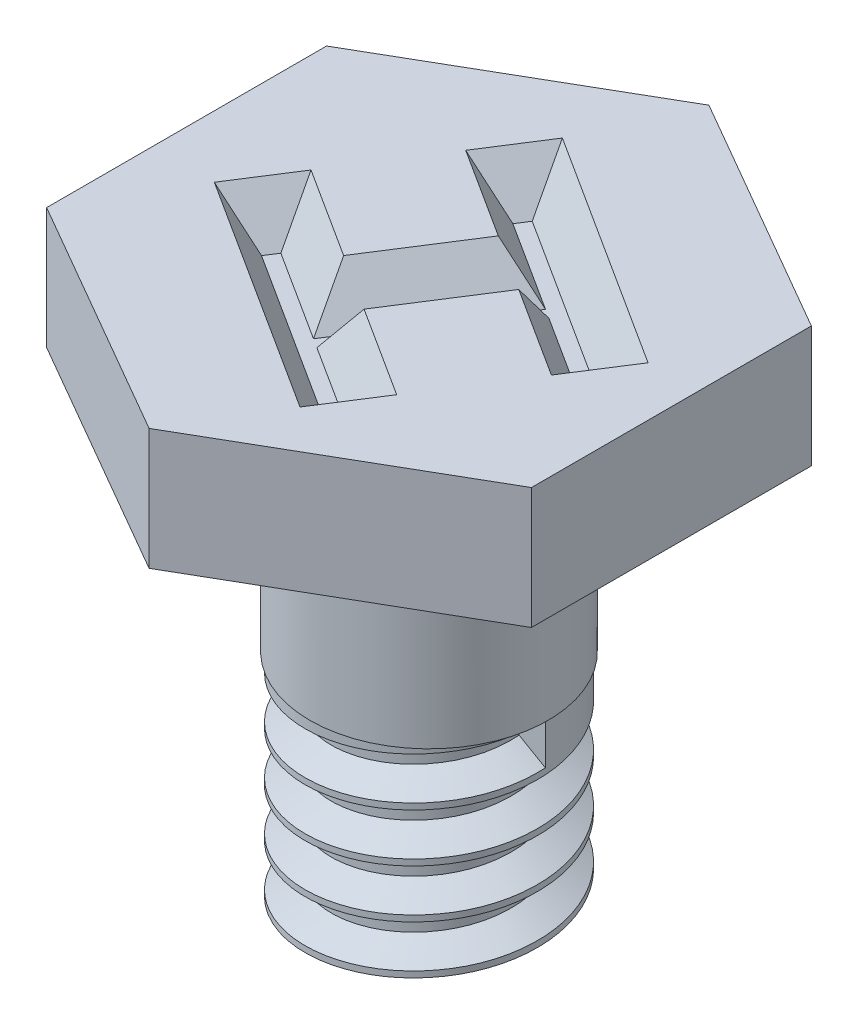
from build123d import *
from OCP.BRepFilletAPI import BRepFilletAPI_MakeChamfer
from build123d.topology import SkipClean

# Parameters (mm, degrees)
SKETCH1_R           = 4.8
BOSS_EXTRUDE1_DEPTH = 17.5
BOSS_EXTRUDE2_DEPTH = 5
CUT_EXTRUDE1_DEPTH  = 2
THREAD1_PITCH       = 2
CHAMFER1_SIZE       = 2
CHAMFER1_SIZE_2     = 1.154700538
BOSS_EXTRUDE3_START = 8.75
SKETCH6_R           = 4.9125
SKETCH6_R_2         = 4.8
BOSS_EXTRUDE3_DEPTH = 8.75


with BuildPart() as part:
    # Sketch1 → Boss-Extrude1 (new body)
    with BuildSketch(Plane(origin=(0, 0, 0), x_dir=(1, 0, 0), z_dir=(0, 1, 0))):
        with Locations(Location((0, 0, 0), (0, 0, 270))):
            Circle(SKETCH1_R)
    extrude(amount=BOSS_EXTRUDE1_DEPTH)

    # Sketch2 → Boss-Extrude2 (add)
    with BuildSketch(Plane(origin=(0, 17.5, 0), x_dir=(1, 0, 0), z_dir=(0, 1, 0))):
        Polygon((0, 11.547005384), (-10, 5.773502692), (-10, -5.773502692), (0, -11.547005384), (10, -5.773502692), (10, 5.773502692), align=None)
    extrude(amount=BOSS_EXTRUDE2_DEPTH)

    # Sketch3 → Cut-Extrude1 (cut)
    with BuildSketch(Plane(origin=(0, 22.5, 0), x_dir=(1, 0, 0), z_dir=(0, 1, 0))):
        Polygon((3.904783525, -5.23763852), (0.174309544, -2.853037898), (2.662588454, 1.039630604), (6.393062435, -1.344970018), (7.948236753, 1.087947796), (-1.84831231, 7.350116385), (-3.403486629, 4.917198571), (0.326987352, 2.53259795), (-2.161291557, -1.360070552), (-5.891765539, 1.024530069), (-7.446939857, -1.408387745), (2.349609207, -7.670556334), align=None)
    extrude(amount=-CUT_EXTRUDE1_DEPTH, mode=Mode.SUBTRACT)

    # Thread1: the profile of Thread Profile1 profile screwed along a right-hand helix of 5 turns, 10 arcs to a turn; built about Z, then put on its axis
    thread1_z = Axis((0, 0, 0), (0, 0, 1))
    thread1_corners = [(4.8003, 0, -0.000173205), (4.8003, 0, 1.7501732), (3.71746825, 0, 1.124999997), (3.71746825, 0, 0.624999997)]
    with BuildLine(mode=Mode.PRIVATE) as thread1_profile:
        Line(thread1_corners[0], thread1_corners[1])
        Line(thread1_corners[1], thread1_corners[2])
        Line(thread1_corners[2], thread1_corners[3])
        Line(thread1_corners[3], thread1_corners[0])
    thread1_cap = Face(thread1_profile.wire())
    thread1_turn_angles = [0, 18, 36, 54, 72, 90, 108, 126, 144, 162, 180, 198, 216, 234, 252, 270, 288, 306, 324, 342, 360]
    thread1_turn_weights = [1, 0.9510565162951535, 1, 0.9510565162951535, 1, 0.9510565162951535, 1, 0.9510565162951535, 1, 0.9510565162951535, 1, 0.9510565162951535, 1, 0.9510565162951535, 1, 0.9510565162951535, 1, 0.9510565162951535, 1, 0.9510565162951535, 1]
    thread1_turn_rails = [Edge.make_bspline([Vector(p[0], p[1], 0).rotate(thread1_z, thread1_turn_angles[k]) / thread1_turn_weights[k] + Vector(0, 0, p[2] + THREAD1_PITCH * thread1_turn_angles[k] / 360) for k in range(21)], [0, 0, 0, 1, 1, 2, 2, 3, 3, 4, 4, 5, 5, 6, 6, 7, 7, 8, 8, 9, 9, 10, 10, 10], 2, thread1_turn_weights) for p in thread1_corners]
    thread1_turn_sides = [Face.make_surface_from_curves(thread1_turn_rails[p[0]], thread1_turn_rails[p[1]]) for p in [(0, 1), (1, 2), (2, 3), (3, 0)]]
    thread1 = Plane(origin=(0, -3, 0), x_dir=(1, 0, 0), z_dir=(0, 1, 0)) * Solid(Shell([*[p.moved(Location((0, 0, THREAD1_PITCH * i))) for i in range(5) for p in thread1_turn_sides], thread1_cap, thread1_cap.rotate(thread1_z, 1800).moved(Location((0, 0, THREAD1_PITCH * 1800 / 360)))]))
    add(thread1, mode=Mode.SUBTRACT)

    # Chamfer1
    chamfer1_edges_1 = [part.edges().sort_by_distance(p)[0] for p in [
        (2.039546535, 20.5, 4.045338209),
    ]]
    chamfer1_side_1 = [part.faces().sort_by_distance(p)[0] for p in [
        (2.039546535, 20.523094011, 4.045338209),
    ]]
    chamfer1_edges_2 = [part.edges().sort_by_distance(p)[0] for p in [
        (3.127196366, 20.5, 6.454097427),
    ]]
    chamfer1_side_2 = [part.faces().sort_by_distance(p)[0] for p in [
        (3.127196366, 20.523094011, 6.454097427),
    ]]
    chamfer1_edges_3 = [part.edges().sort_by_distance(p)[0] for p in [
        (-2.548665325, 20.5, 4.539472039),
    ]]
    chamfer1_side_3 = [part.faces().sort_by_distance(p)[0] for p in [
        (-2.548665325, 20.523094011, 4.539472039),
    ]]
    chamfer1_edges_4 = [part.edges().sort_by_distance(p)[0] for p in [
        (-6.669352698, 20.5, 0.191928838),
    ]]
    chamfer1_side_4 = [part.faces().sort_by_distance(p)[0] for p in [
        (-6.669352698, 20.523094011, 0.191928838),
    ]]
    chamfer1_edges_5 = [part.edges().sort_by_distance(p)[0] for p in [
        (-4.026528548, 20.5, 0.167770242),
    ]]
    chamfer1_side_5 = [part.faces().sort_by_distance(p)[0] for p in [
        (-4.026528548, 20.523094011, 0.167770242),
    ]]
    chamfer1_edges_6 = [part.edges().sort_by_distance(p)[0] for p in [
        (-0.917152102, 20.5, -0.586263699),
    ]]
    chamfer1_side_6 = [part.faces().sort_by_distance(p)[0] for p in [
        (-0.917152102, 20.523094011, -0.586263699),
    ]]
    chamfer1_edges_7 = [part.edges().sort_by_distance(p)[0] for p in [
        (-1.538249638, 20.5, -3.724898261),
    ]]
    chamfer1_side_7 = [part.faces().sort_by_distance(p)[0] for p in [
        (-1.538249638, 20.523094011, -3.724898261),
    ]]
    chamfer1_edges_8 = [part.edges().sort_by_distance(p)[0] for p in [
        (-2.62589947, 20.5, -6.133657478),
    ]]
    chamfer1_side_8 = [part.faces().sort_by_distance(p)[0] for p in [
        (-2.62589947, 20.523094011, -6.133657478),
    ]]
    chamfer1_edges_9 = [part.edges().sort_by_distance(p)[0] for p in [
        (3.049962221, 20.5, -4.219032091),
    ]]
    chamfer1_side_9 = [part.faces().sort_by_distance(p)[0] for p in [
        (3.049962221, 20.523094011, -4.219032091),
    ]]
    chamfer1_edges_10 = [part.edges().sort_by_distance(p)[0] for p in [
        (7.170649594, 20.5, 0.128511111),
    ]]
    chamfer1_side_10 = [part.faces().sort_by_distance(p)[0] for p in [
        (7.170649594, 20.523094011, 0.128511111),
    ]]
    chamfer1_edges_11 = [part.edges().sort_by_distance(p)[0] for p in [
        (4.527825444, 20.5, 0.152669707),
    ]]
    chamfer1_side_11 = [part.faces().sort_by_distance(p)[0] for p in [
        (4.527825444, 20.523094011, 0.152669707),
    ]]
    chamfer1_edges_12 = [part.edges().sort_by_distance(p)[0] for p in [
        (1.418448999, 20.5, 0.906703647),
    ]]
    chamfer1_side_12 = [part.faces().sort_by_distance(p)[0] for p in [
        (1.418448999, 20.523094011, 0.906703647),
    ]]
    chamfer1 = BRepFilletAPI_MakeChamfer(part.part.solid().wrapped)
    for e in chamfer1_edges_1:
        chamfer1.Add(CHAMFER1_SIZE - 0.0001, CHAMFER1_SIZE_2 - 0.0001, e.wrapped, chamfer1_side_1[0].wrapped)
    for e in chamfer1_edges_2:
        chamfer1.Add(CHAMFER1_SIZE - 0.0001, CHAMFER1_SIZE_2 - 0.0001, e.wrapped, chamfer1_side_2[0].wrapped)
    for e in chamfer1_edges_3:
        chamfer1.Add(CHAMFER1_SIZE - 0.0001, CHAMFER1_SIZE_2 - 0.0001, e.wrapped, chamfer1_side_3[0].wrapped)
    for e in chamfer1_edges_4:
        chamfer1.Add(CHAMFER1_SIZE - 0.0001, CHAMFER1_SIZE_2 - 0.0001, e.wrapped, chamfer1_side_4[0].wrapped)
    for e in chamfer1_edges_5:
        chamfer1.Add(CHAMFER1_SIZE - 0.0001, CHAMFER1_SIZE_2 - 0.0001, e.wrapped, chamfer1_side_5[0].wrapped)
    for e in chamfer1_edges_6:
        chamfer1.Add(CHAMFER1_SIZE - 0.0001, CHAMFER1_SIZE_2 - 0.0001, e.wrapped, chamfer1_side_6[0].wrapped)
    for e in chamfer1_edges_7:
        chamfer1.Add(CHAMFER1_SIZE - 0.0001, CHAMFER1_SIZE_2 - 0.0001, e.wrapped, chamfer1_side_7[0].wrapped)
    for e in chamfer1_edges_8:
        chamfer1.Add(CHAMFER1_SIZE - 0.0001, CHAMFER1_SIZE_2 - 0.0001, e.wrapped, chamfer1_side_8[0].wrapped)
    for e in chamfer1_edges_9:
        chamfer1.Add(CHAMFER1_SIZE - 0.0001, CHAMFER1_SIZE_2 - 0.0001, e.wrapped, chamfer1_side_9[0].wrapped)
    for e in chamfer1_edges_10:
        chamfer1.Add(CHAMFER1_SIZE - 0.0001, CHAMFER1_SIZE_2 - 0.0001, e.wrapped, chamfer1_side_10[0].wrapped)
    for e in chamfer1_edges_11:
        chamfer1.Add(CHAMFER1_SIZE - 0.0001, CHAMFER1_SIZE_2 - 0.0001, e.wrapped, chamfer1_side_11[0].wrapped)
    for e in chamfer1_edges_12:
        chamfer1.Add(CHAMFER1_SIZE - 0.0001, CHAMFER1_SIZE_2 - 0.0001, e.wrapped, chamfer1_side_12[0].wrapped)
    add(Compound.cast(chamfer1.Shape()), mode=Mode.REPLACE)  # a hair under: the kernel refuses the full size

    # Sketch6 → Boss-Extrude3 (add)
    with SkipClean():  # the faces are left unmerged after this step: merging them gives an invalid solid
        with BuildSketch(Plane.XZ.offset(-17.5).offset(BOSS_EXTRUDE3_START)):
            with Locations(Location((0, 0, 0), (0, 0, 90))):
                Circle(SKETCH6_R)
            Circle(SKETCH6_R_2, mode=Mode.SUBTRACT)
        extrude(amount=-BOSS_EXTRUDE3_DEPTH)


solid = part.part
